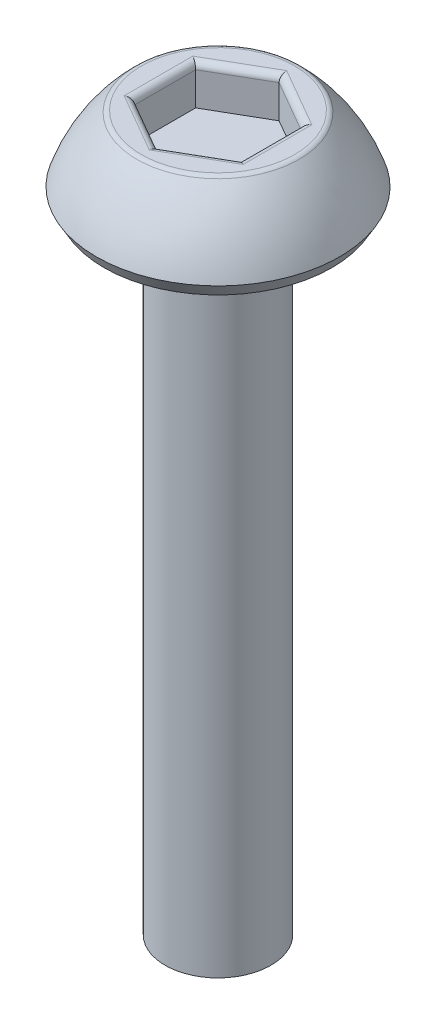
from build123d import *

# Parameters (mm, degrees)
CUT_EXTRUDE1_DEPTH = 0.75
FILLET1_R          = 0.125


with BuildPart() as part:
    # Sketch1 → Revolve1 (revolve)
    with BuildSketch(Plane(origin=(0, 0, 0), x_dir=(0, 0, -1), z_dir=(1, 0, 0))):
        with BuildLine():
            Line((0, 1.5), (-1.5, 1.5))
            ThreePointArc((-1.5, 1.5), (-1.978515811, 0.925250119), (-2.3, 0.25))
            Line((-2.3, 0.25), (-2.155662433, 0))
            Line((-2.155662433, 0), (-1, 0))
            Line((-1, 0), (-1, -12))
            Line((-1, -12), (0, -12))
            Line((0, -12), (0, 1.5))
        make_face()
    revolve(axis=Axis((0, -12, 0), (0, 1, 0)))

    # Sketch2 → Cut-Extrude1 (cut)
    with BuildSketch(Plane(origin=(0, 1.5, 0), x_dir=(1, 0, 0), z_dir=(0, 1, 0))):
        Polygon((0, 1.154700538), (-1, 0.577350269), (-1, -0.577350269), (0, -1.154700538), (1, -0.577350269), (1, 0.577350269), align=None)
    extrude(amount=-CUT_EXTRUDE1_DEPTH, mode=Mode.SUBTRACT)

    # Fillet1
    fillet1_edges = [part.edges().sort_by_distance(p)[0] for p in [
        (0, 1.5, -1.5),
        (-0.5, 1.5, 0.866025404),
        (0.5, 1.5, 0.866025404),
        (1, 1.5, 0),
        (0.5, 1.5, -0.866025404),
        (-0.5, 1.5, -0.866025404),
        (-1, 1.5, 0),
    ]]
    fillet(fillet1_edges, radius=FILLET1_R)


solid = part.part
